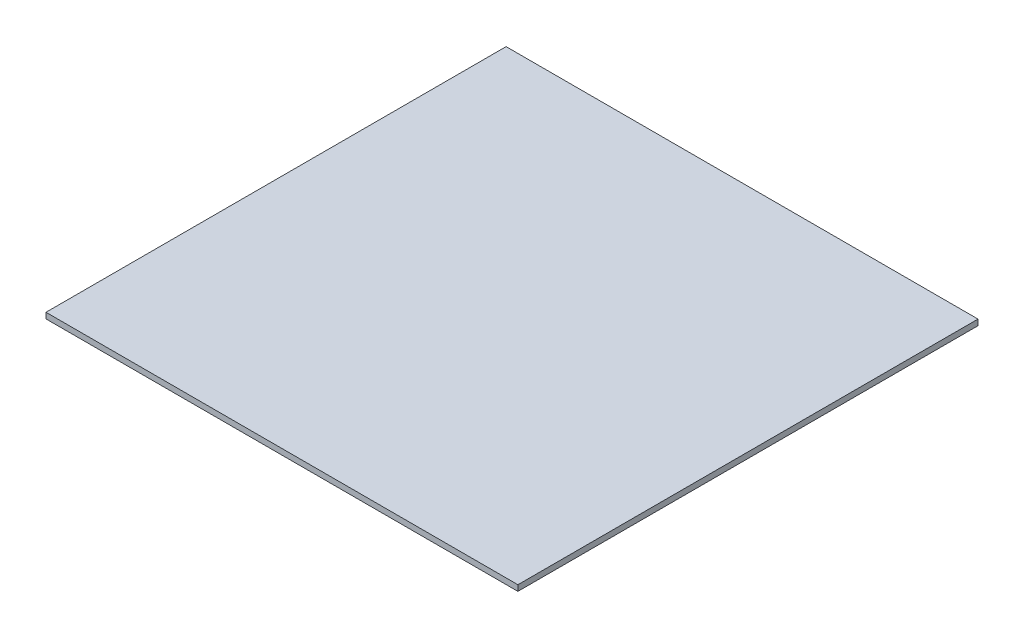
from build123d import *

# Parameters (mm, degrees)
SKETCH2_W          = 400
SKETCH2_H          = 390
BASE_FLANGE2_DEPTH = 4.9


# Sheet-metal steps are written as plain solids
with BuildPart() as part:
    # Sketch2 → Base-Flange2 (new body)
    with BuildSketch(Plane(origin=(0, 0, 0), x_dir=(1, 0, 0), z_dir=(0, 1, 0))):
        with Locations((0, 195)):
            Rectangle(SKETCH2_W, SKETCH2_H)
    extrude(amount=-BASE_FLANGE2_DEPTH)


solid = part.part
